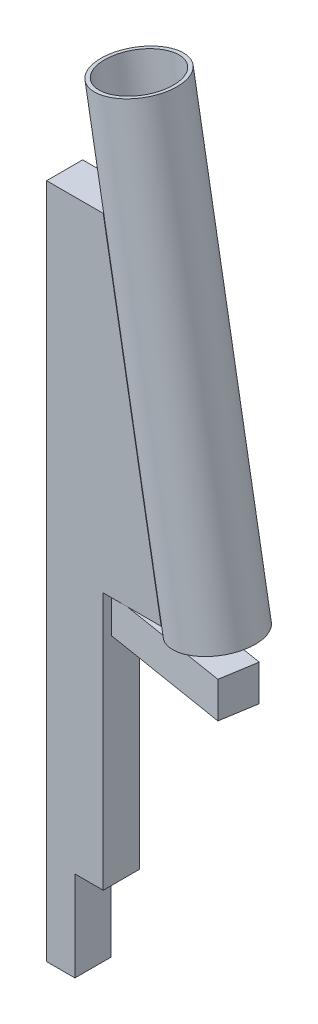
from build123d import *

# Parameters (mm, degrees)
MAIN_EXTRUSION_DEPTH = 14
LOCK_EXTRUSION_DEPTH = 28
ESQUISSE3_R          = 30
ESQUISSE3_R_2        = 27
PLEXIGLAS_DEPTH      = 350


with BuildPart() as part:
    # Esquisse1 → Main Extrusion (new, symmetric)
    with BuildSketch(Plane.XY):
        Polygon((0, 525.207681883), (0, 0), (22, 0), (22, 70), (44, 70), (44, 270), (89, 270), (44, 525.207681883), align=None)
    extrude(amount=MAIN_EXTRUSION_DEPTH, both=True)

    # Esquisse2 → Lock Extrusion (add)
    with BuildSketch(Plane(origin=(0, 270, 0), x_dir=(-1, 0, 0), z_dir=(0, -1, 0))):
        Polygon((-47.932439792, -11.56864335), (-146.633166785, -27.636203558), (-151.132083643, 0), (-52.43135665, 16.067560208), align=None)
    extrude(amount=LOCK_EXTRUSION_DEPTH)


with BuildPart() as body_2:
    # Esquisse3 → Plexiglas (new body)
    with BuildSketch(Plane(origin=(-43.489040974, 246.638607428, 0), x_dir=(0, 0, -1), z_dir=(0.1736481776669273, -0.9848077530122086, 0))):
        with Locations((0, 164.532897988)):
            Circle(ESQUISSE3_R)
        with Locations((0, 164.532897988)):
            Circle(ESQUISSE3_R_2, mode=Mode.SUBTRACT)
    extrude(amount=-PLEXIGLAS_DEPTH)


solid = Compound([part.part, body_2.part])
